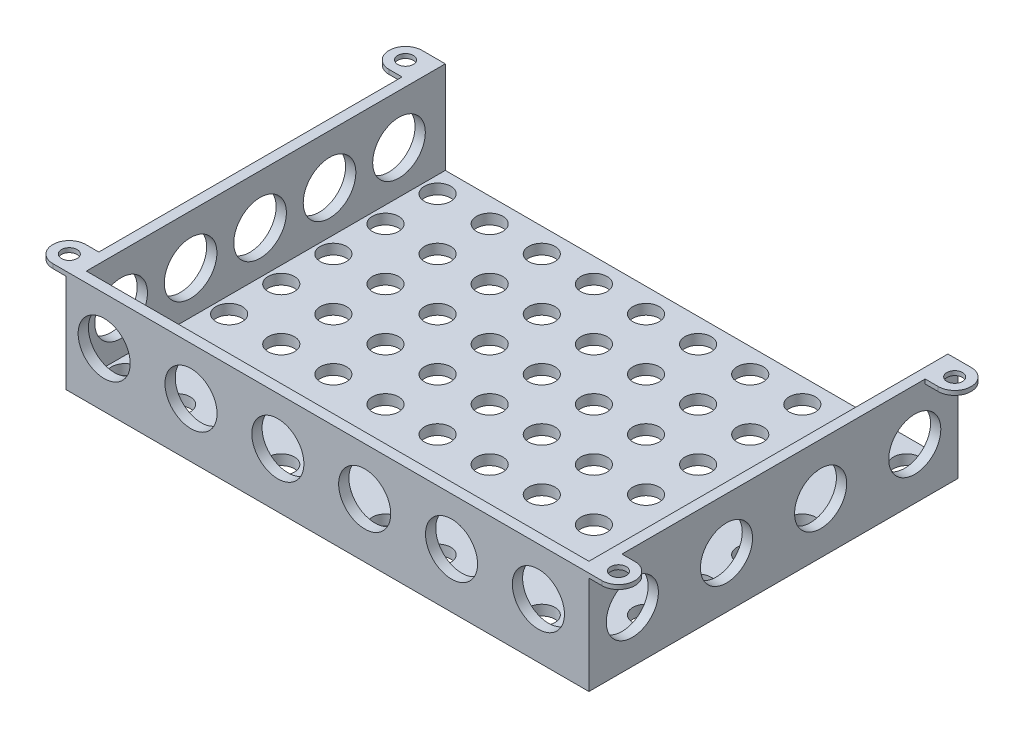
from build123d import *

# Parameters (mm, degrees)
SKETCH1_W                  = 153
SKETCH1_H                  = 108
BOSS_EXTRUDE1_DEPTH        = 30
SHELL1_T                   = -3
SKETCH7_R                  = 2.286
BOSS_EXTRUDE7_DEPTH        = 1.27
SKETCH24_R                 = 3.845268573
CUT_EXTRUDE8_DEPTH         = 25.4
LPATTERN5_COUNT            = 10
LPATTERN5_PITCH            = 15.24
LPATTERN6_COPY_1_SKETCH_R  = 3.845268573
LPATTERN6_COPY_1_DEPTH     = 25.4
LPATTERN6_COPY_2_SKETCH_R  = 3.845268573
LPATTERN6_COPY_2_DEPTH     = 25.4
LPATTERN6_COPY_3_SKETCH_R  = 3.845268573
LPATTERN6_COPY_3_DEPTH     = 25.4
LPATTERN6_COPY_4_SKETCH_R  = 3.845268573
LPATTERN6_COPY_4_DEPTH     = 25.4
LPATTERN6_COPY_5_SKETCH_R  = 3.845268573
LPATTERN6_COPY_5_DEPTH     = 25.4
LPATTERN6_COPY_6_SKETCH_R  = 3.845268573
LPATTERN6_COPY_6_DEPTH     = 25.4
LPATTERN6_COPY_7_SKETCH_R  = 3.845268573
LPATTERN6_COPY_7_DEPTH     = 25.4
LPATTERN6_COPY_8_SKETCH_R  = 3.845268573
LPATTERN6_COPY_8_DEPTH     = 25.4
LPATTERN6_COPY_9_SKETCH_R  = 3.845268573
LPATTERN6_COPY_9_DEPTH     = 25.4
LPATTERN6_COPY_10_SKETCH_R = 3.845268573
LPATTERN6_COPY_10_DEPTH    = 25.4
LPATTERN6_COPY_11_SKETCH_R = 3.845268573
LPATTERN6_COPY_11_DEPTH    = 25.4
LPATTERN6_COPY_12_SKETCH_R = 3.845268573
LPATTERN6_COPY_12_DEPTH    = 25.4
LPATTERN6_COPY_13_SKETCH_R = 3.845268573
LPATTERN6_COPY_13_DEPTH    = 25.4
LPATTERN6_COPY_14_SKETCH_R = 3.845268573
LPATTERN6_COPY_14_DEPTH    = 25.4
LPATTERN6_COPY_15_SKETCH_R = 3.845268573
LPATTERN6_COPY_15_DEPTH    = 25.4
LPATTERN6_COPY_16_SKETCH_R = 3.845268573
LPATTERN6_COPY_16_DEPTH    = 25.4
LPATTERN6_COPY_17_SKETCH_R = 3.845268573
LPATTERN6_COPY_17_DEPTH    = 25.4
LPATTERN6_COPY_18_SKETCH_R = 3.845268573
LPATTERN6_COPY_18_DEPTH    = 25.4
LPATTERN6_COPY_19_SKETCH_R = 3.845268573
LPATTERN6_COPY_19_DEPTH    = 25.4
LPATTERN6_COPY_20_SKETCH_R = 3.845268573
LPATTERN6_COPY_20_DEPTH    = 25.4
LPATTERN6_COPY_21_SKETCH_R = 3.845268573
LPATTERN6_COPY_21_DEPTH    = 25.4
LPATTERN6_COPY_22_SKETCH_R = 3.845268573
LPATTERN6_COPY_22_DEPTH    = 25.4
LPATTERN6_COPY_23_SKETCH_R = 3.845268573
LPATTERN6_COPY_23_DEPTH    = 25.4
LPATTERN6_COPY_24_SKETCH_R = 3.845268573
LPATTERN6_COPY_24_DEPTH    = 25.4
LPATTERN6_COPY_25_SKETCH_R = 3.845268573
LPATTERN6_COPY_25_DEPTH    = 25.4
LPATTERN6_COPY_26_SKETCH_R = 3.845268573
LPATTERN6_COPY_26_DEPTH    = 25.4
LPATTERN6_COPY_27_SKETCH_R = 3.845268573
LPATTERN6_COPY_27_DEPTH    = 25.4
LPATTERN6_COPY_28_SKETCH_R = 3.845268573
LPATTERN6_COPY_28_DEPTH    = 25.4
LPATTERN6_COPY_29_SKETCH_R = 3.845268573
LPATTERN6_COPY_29_DEPTH    = 25.4
LPATTERN6_COPY_30_SKETCH_R = 3.845268573
LPATTERN6_COPY_30_DEPTH    = 25.4
LPATTERN6_COPY_31_SKETCH_R = 3.845268573
LPATTERN6_COPY_31_DEPTH    = 25.4
LPATTERN6_COPY_32_SKETCH_R = 3.845268573
LPATTERN6_COPY_32_DEPTH    = 25.4
LPATTERN6_COPY_33_SKETCH_R = 3.845268573
LPATTERN6_COPY_33_DEPTH    = 25.4
LPATTERN6_COPY_34_SKETCH_R = 3.845268573
LPATTERN6_COPY_34_DEPTH    = 25.4
LPATTERN6_COPY_35_SKETCH_R = 3.845268573
LPATTERN6_COPY_35_DEPTH    = 25.4
LPATTERN6_COPY_36_SKETCH_R = 3.845268573
LPATTERN6_COPY_36_DEPTH    = 25.4
LPATTERN6_COPY_37_SKETCH_R = 3.845268573
LPATTERN6_COPY_37_DEPTH    = 25.4
LPATTERN6_COPY_38_SKETCH_R = 3.845268573
LPATTERN6_COPY_38_DEPTH    = 25.4
LPATTERN6_COPY_39_SKETCH_R = 3.845268573
LPATTERN6_COPY_39_DEPTH    = 25.4
LPATTERN6_COPY_40_SKETCH_R = 3.845268573
LPATTERN6_COPY_40_DEPTH    = 25.4
LPATTERN6_COPY_41_SKETCH_R = 3.845268573
LPATTERN6_COPY_41_DEPTH    = 25.4
LPATTERN6_COPY_42_SKETCH_R = 3.845268573
LPATTERN6_COPY_42_DEPTH    = 25.4
LPATTERN6_COPY_43_SKETCH_R = 3.845268573
LPATTERN6_COPY_43_DEPTH    = 25.4
LPATTERN6_COPY_44_SKETCH_R = 3.845268573
LPATTERN6_COPY_44_DEPTH    = 25.4
LPATTERN6_COPY_45_SKETCH_R = 3.845268573
LPATTERN6_COPY_45_DEPTH    = 25.4
LPATTERN6_COPY_46_SKETCH_R = 3.845268573
LPATTERN6_COPY_46_DEPTH    = 25.4
LPATTERN6_COPY_47_SKETCH_R = 3.845268573
LPATTERN6_COPY_47_DEPTH    = 25.4
LPATTERN6_COPY_48_SKETCH_R = 3.845268573
LPATTERN6_COPY_48_DEPTH    = 25.4
LPATTERN6_COPY_49_SKETCH_R = 3.845268573
LPATTERN6_COPY_49_DEPTH    = 25.4
LPATTERN6_COPY_50_SKETCH_R = 3.845268573
LPATTERN6_COPY_50_DEPTH    = 25.4
LPATTERN6_COPY_51_SKETCH_R = 3.845268573
LPATTERN6_COPY_51_DEPTH    = 25.4
LPATTERN6_COPY_52_SKETCH_R = 3.845268573
LPATTERN6_COPY_52_DEPTH    = 25.4
LPATTERN6_COPY_53_SKETCH_R = 3.845268573
LPATTERN6_COPY_53_DEPTH    = 25.4
LPATTERN6_COPY_54_SKETCH_R = 3.845268573
LPATTERN6_COPY_54_DEPTH    = 25.4
LPATTERN6_COPY_55_SKETCH_R = 3.845268573
LPATTERN6_COPY_55_DEPTH    = 25.4
LPATTERN6_COPY_56_SKETCH_R = 3.845268573
LPATTERN6_COPY_56_DEPTH    = 25.4
LPATTERN6_COPY_57_SKETCH_R = 3.845268573
LPATTERN6_COPY_57_DEPTH    = 25.4
LPATTERN6_COPY_58_SKETCH_R = 3.845268573
LPATTERN6_COPY_58_DEPTH    = 25.4
LPATTERN6_COPY_59_SKETCH_R = 3.845268573
LPATTERN6_COPY_59_DEPTH    = 25.4
LPATTERN6_COPY_60_SKETCH_R = 3.845268573
LPATTERN6_COPY_60_DEPTH    = 25.4
LPATTERN6_COPY_61_SKETCH_R = 3.845268573
LPATTERN6_COPY_61_DEPTH    = 25.4
LPATTERN6_COPY_62_SKETCH_R = 3.845268573
LPATTERN6_COPY_62_DEPTH    = 25.4
LPATTERN6_COPY_63_SKETCH_R = 3.845268573
LPATTERN6_COPY_63_DEPTH    = 25.4
LPATTERN6_COPY_64_SKETCH_R = 3.845268573
LPATTERN6_COPY_64_DEPTH    = 25.4
LPATTERN6_COPY_65_SKETCH_R = 3.845268573
LPATTERN6_COPY_65_DEPTH    = 25.4
LPATTERN6_COPY_66_SKETCH_R = 3.845268573
LPATTERN6_COPY_66_DEPTH    = 25.4
LPATTERN6_COPY_67_SKETCH_R = 3.845268573
LPATTERN6_COPY_67_DEPTH    = 25.4
LPATTERN6_COPY_68_SKETCH_R = 3.845268573
LPATTERN6_COPY_68_DEPTH    = 25.4
LPATTERN6_COPY_69_SKETCH_R = 3.845268573
LPATTERN6_COPY_69_DEPTH    = 25.4
LPATTERN6_COPY_70_SKETCH_R = 3.845268573
LPATTERN6_COPY_70_DEPTH    = 25.4
LPATTERN6_COPY_71_SKETCH_R = 3.845268573
LPATTERN6_COPY_71_DEPTH    = 25.4
LPATTERN6_COPY_72_SKETCH_R = 3.845268573
LPATTERN6_COPY_72_DEPTH    = 25.4
LPATTERN6_COPY_73_SKETCH_R = 3.845268573
LPATTERN6_COPY_73_DEPTH    = 25.4
LPATTERN6_COPY_74_SKETCH_R = 3.845268573
LPATTERN6_COPY_74_DEPTH    = 25.4
LPATTERN6_COPY_75_SKETCH_R = 3.845268573
LPATTERN6_COPY_75_DEPTH    = 25.4
LPATTERN6_COPY_76_SKETCH_R = 3.845268573
LPATTERN6_COPY_76_DEPTH    = 25.4
LPATTERN6_COPY_77_SKETCH_R = 3.845268573
LPATTERN6_COPY_77_DEPTH    = 25.4
LPATTERN6_COPY_78_SKETCH_R = 3.845268573
LPATTERN6_COPY_78_DEPTH    = 25.4
LPATTERN6_COPY_79_SKETCH_R = 3.845268573
LPATTERN6_COPY_79_DEPTH    = 25.4
LPATTERN6_COPY_80_SKETCH_R = 3.845268573
LPATTERN6_COPY_80_DEPTH    = 25.4
LPATTERN6_COPY_81_SKETCH_R = 3.845268573
LPATTERN6_COPY_81_DEPTH    = 25.4
LPATTERN6_COPY_82_SKETCH_R = 3.845268573
LPATTERN6_COPY_82_DEPTH    = 25.4
LPATTERN6_COPY_83_SKETCH_R = 3.845268573
LPATTERN6_COPY_83_DEPTH    = 25.4
LPATTERN6_COPY_84_SKETCH_R = 3.845268573
LPATTERN6_COPY_84_DEPTH    = 25.4
LPATTERN6_COPY_85_SKETCH_R = 3.845268573
LPATTERN6_COPY_85_DEPTH    = 25.4
LPATTERN6_COPY_86_SKETCH_R = 3.845268573
LPATTERN6_COPY_86_DEPTH    = 25.4
LPATTERN6_COPY_87_SKETCH_R = 3.845268573
LPATTERN6_COPY_87_DEPTH    = 25.4
LPATTERN6_COPY_88_SKETCH_R = 3.845268573
LPATTERN6_COPY_88_DEPTH    = 25.4
LPATTERN6_COPY_89_SKETCH_R = 3.845268573
LPATTERN6_COPY_89_DEPTH    = 25.4
LPATTERN6_COPY_90_SKETCH_R = 3.845268573
LPATTERN6_COPY_90_DEPTH    = 25.4
SKETCH27_W                 = 147
SKETCH27_H                 = 27
CUT_EXTRUDE10_DEPTH        = 5.08
SKETCH28_R                 = 7.698234168
CUT_EXTRUDE11_DEPTH        = 10.16
LPATTERN7_COUNT            = 5
LPATTERN7_PITCH            = 20.32
SKETCH29_R                 = 7.62
CUT_EXTRUDE13_DEPTH        = 7.62
LPATTERN9_COUNT            = 6
LPATTERN9_PITCH            = 25.4
SKETCH30_R                 = 7.62
CUT_EXTRUDE14_DEPTH        = 7.62
MIRROR2_COPY_1_SKETCH_R    = 2.286
MIRROR2_COPY_1_DEPTH       = 1.27
MIRROR2_COPY_2_SKETCH_R    = 2.286
MIRROR2_COPY_2_DEPTH       = 1.27


with BuildPart() as part:
    # Sketch1 → Boss-Extrude1 (new body)
    with BuildSketch(Plane(origin=(0, 0, 0), x_dir=(1, 0, 0), z_dir=(0, 1, 0))):
        with Locations((-76.5, -54)):
            Rectangle(SKETCH1_W, SKETCH1_H)
    extrude(amount=BOSS_EXTRUDE1_DEPTH)

    # Shell1
    shell1_openings = [part.faces().sort_by_distance(p)[0] for p in [
        (-76.5, 30, 54),
    ]]
    offset(amount=SHELL1_T, openings=shell1_openings, kind=Kind.INTERSECTION)

    # Sketch7 → Boss-Extrude7 (add)
    with BuildSketch(Plane(origin=(0, 30, 0), x_dir=(1, 0, 0), z_dir=(0, 1, 0))):
        with BuildLine():
            Line((-156.81, 0), (-153, 0))
            Line((-153, 0), (-153, -9.652))
            Line((-153, -9.652), (-156.81, -9.652))
            ThreePointArc((-156.81, -9.652), (-161.636, -4.826), (-156.81, 0))
        make_face()
        with Locations((-156.81, -4.826)):
            Circle(SKETCH7_R, mode=Mode.SUBTRACT)
    boss_extrude7 = extrude(amount=-BOSS_EXTRUDE7_DEPTH)

    # Sketch24 → Cut-Extrude8 (cut)
    with BuildSketch(Plane.XZ):
        with Locations((-8.055715174, 7.051094555)):
            Circle(SKETCH24_R)
    cut_extrude8 = extrude(amount=-CUT_EXTRUDE8_DEPTH, mode=Mode.SUBTRACT)

    # LPattern5: Cut-Extrude8 ×10
    with Locations(*[(-i * LPATTERN5_PITCH, 0, 0) for i in range(1, LPATTERN5_COUNT)]):
        add(cut_extrude8, mode=Mode.SUBTRACT)

    # LPattern6 copy 1 sketch → LPattern6 copy 1 (cut)
    with BuildSketch(Plane(origin=(-15.24, 0, 15.24), x_dir=(1, 0, 0), z_dir=(0, -1, 0))):
        with Locations((-8.055715174, 7.051094555)):
            Circle(LPATTERN6_COPY_1_SKETCH_R)
    extrude(amount=-LPATTERN6_COPY_1_DEPTH, mode=Mode.SUBTRACT)

    # LPattern6 copy 2 sketch → LPattern6 copy 2 (cut)
    with BuildSketch(Plane(origin=(-15.24, 0, 30.48), x_dir=(1, 0, 0), z_dir=(0, -1, 0))):
        with Locations((-8.055715174, 7.051094555)):
            Circle(LPATTERN6_COPY_2_SKETCH_R)
    extrude(amount=-LPATTERN6_COPY_2_DEPTH, mode=Mode.SUBTRACT)

    # LPattern6 copy 3 sketch → LPattern6 copy 3 (cut)
    with BuildSketch(Plane(origin=(-15.24, 0, 45.72), x_dir=(1, 0, 0), z_dir=(0, -1, 0))):
        with Locations((-8.055715174, 7.051094555)):
            Circle(LPATTERN6_COPY_3_SKETCH_R)
    extrude(amount=-LPATTERN6_COPY_3_DEPTH, mode=Mode.SUBTRACT)

    # LPattern6 copy 4 sketch → LPattern6 copy 4 (cut)
    with BuildSketch(Plane(origin=(-15.24, 0, 60.96), x_dir=(1, 0, 0), z_dir=(0, -1, 0))):
        with Locations((-8.055715174, 7.051094555)):
            Circle(LPATTERN6_COPY_4_SKETCH_R)
    extrude(amount=-LPATTERN6_COPY_4_DEPTH, mode=Mode.SUBTRACT)

    # LPattern6 copy 5 sketch → LPattern6 copy 5 (cut)
    with BuildSketch(Plane(origin=(-15.24, 0, 76.2), x_dir=(1, 0, 0), z_dir=(0, -1, 0))):
        with Locations((-8.055715174, 7.051094555)):
            Circle(LPATTERN6_COPY_5_SKETCH_R)
    extrude(amount=-LPATTERN6_COPY_5_DEPTH, mode=Mode.SUBTRACT)

    # LPattern6 copy 6 sketch → LPattern6 copy 6 (cut)
    with BuildSketch(Plane(origin=(-15.24, 0, 91.44), x_dir=(1, 0, 0), z_dir=(0, -1, 0))):
        with Locations((-8.055715174, 7.051094555)):
            Circle(LPATTERN6_COPY_6_SKETCH_R)
    extrude(amount=-LPATTERN6_COPY_6_DEPTH, mode=Mode.SUBTRACT)

    # LPattern6 copy 7 sketch → LPattern6 copy 7 (cut)
    with BuildSketch(Plane(origin=(-15.24, 0, 106.68), x_dir=(1, 0, 0), z_dir=(0, -1, 0))):
        with Locations((-8.055715174, 7.051094555)):
            Circle(LPATTERN6_COPY_7_SKETCH_R)
    extrude(amount=-LPATTERN6_COPY_7_DEPTH, mode=Mode.SUBTRACT)

    # LPattern6 copy 8 sketch → LPattern6 copy 8 (cut)
    with BuildSketch(Plane(origin=(-15.24, 0, 121.92), x_dir=(1, 0, 0), z_dir=(0, -1, 0))):
        with Locations((-8.055715174, 7.051094555)):
            Circle(LPATTERN6_COPY_8_SKETCH_R)
    extrude(amount=-LPATTERN6_COPY_8_DEPTH, mode=Mode.SUBTRACT)

    # LPattern6 copy 9 sketch → LPattern6 copy 9 (cut)
    with BuildSketch(Plane(origin=(-15.24, 0, 137.16), x_dir=(1, 0, 0), z_dir=(0, -1, 0))):
        with Locations((-8.055715174, 7.051094555)):
            Circle(LPATTERN6_COPY_9_SKETCH_R)
    extrude(amount=-LPATTERN6_COPY_9_DEPTH, mode=Mode.SUBTRACT)

    # LPattern6 copy 10 sketch → LPattern6 copy 10 (cut)
    with BuildSketch(Plane(origin=(-30.48, 0, 15.24), x_dir=(1, 0, 0), z_dir=(0, -1, 0))):
        with Locations((-8.055715174, 7.051094555)):
            Circle(LPATTERN6_COPY_10_SKETCH_R)
    extrude(amount=-LPATTERN6_COPY_10_DEPTH, mode=Mode.SUBTRACT)

    # LPattern6 copy 11 sketch → LPattern6 copy 11 (cut)
    with BuildSketch(Plane(origin=(-30.48, 0, 30.48), x_dir=(1, 0, 0), z_dir=(0, -1, 0))):
        with Locations((-8.055715174, 7.051094555)):
            Circle(LPATTERN6_COPY_11_SKETCH_R)
    extrude(amount=-LPATTERN6_COPY_11_DEPTH, mode=Mode.SUBTRACT)

    # LPattern6 copy 12 sketch → LPattern6 copy 12 (cut)
    with BuildSketch(Plane(origin=(-30.48, 0, 45.72), x_dir=(1, 0, 0), z_dir=(0, -1, 0))):
        with Locations((-8.055715174, 7.051094555)):
            Circle(LPATTERN6_COPY_12_SKETCH_R)
    extrude(amount=-LPATTERN6_COPY_12_DEPTH, mode=Mode.SUBTRACT)

    # LPattern6 copy 13 sketch → LPattern6 copy 13 (cut)
    with BuildSketch(Plane(origin=(-30.48, 0, 60.96), x_dir=(1, 0, 0), z_dir=(0, -1, 0))):
        with Locations((-8.055715174, 7.051094555)):
            Circle(LPATTERN6_COPY_13_SKETCH_R)
    extrude(amount=-LPATTERN6_COPY_13_DEPTH, mode=Mode.SUBTRACT)

    # LPattern6 copy 14 sketch → LPattern6 copy 14 (cut)
    with BuildSketch(Plane(origin=(-30.48, 0, 76.2), x_dir=(1, 0, 0), z_dir=(0, -1, 0))):
        with Locations((-8.055715174, 7.051094555)):
            Circle(LPATTERN6_COPY_14_SKETCH_R)
    extrude(amount=-LPATTERN6_COPY_14_DEPTH, mode=Mode.SUBTRACT)

    # LPattern6 copy 15 sketch → LPattern6 copy 15 (cut)
    with BuildSketch(Plane(origin=(-30.48, 0, 91.44), x_dir=(1, 0, 0), z_dir=(0, -1, 0))):
        with Locations((-8.055715174, 7.051094555)):
            Circle(LPATTERN6_COPY_15_SKETCH_R)
    extrude(amount=-LPATTERN6_COPY_15_DEPTH, mode=Mode.SUBTRACT)

    # LPattern6 copy 16 sketch → LPattern6 copy 16 (cut)
    with BuildSketch(Plane(origin=(-30.48, 0, 106.68), x_dir=(1, 0, 0), z_dir=(0, -1, 0))):
        with Locations((-8.055715174, 7.051094555)):
            Circle(LPATTERN6_COPY_16_SKETCH_R)
    extrude(amount=-LPATTERN6_COPY_16_DEPTH, mode=Mode.SUBTRACT)

    # LPattern6 copy 17 sketch → LPattern6 copy 17 (cut)
    with BuildSketch(Plane(origin=(-30.48, 0, 121.92), x_dir=(1, 0, 0), z_dir=(0, -1, 0))):
        with Locations((-8.055715174, 7.051094555)):
            Circle(LPATTERN6_COPY_17_SKETCH_R)
    extrude(amount=-LPATTERN6_COPY_17_DEPTH, mode=Mode.SUBTRACT)

    # LPattern6 copy 18 sketch → LPattern6 copy 18 (cut)
    with BuildSketch(Plane(origin=(-30.48, 0, 137.16), x_dir=(1, 0, 0), z_dir=(0, -1, 0))):
        with Locations((-8.055715174, 7.051094555)):
            Circle(LPATTERN6_COPY_18_SKETCH_R)
    extrude(amount=-LPATTERN6_COPY_18_DEPTH, mode=Mode.SUBTRACT)

    # LPattern6 copy 19 sketch → LPattern6 copy 19 (cut)
    with BuildSketch(Plane(origin=(-45.72, 0, 15.24), x_dir=(1, 0, 0), z_dir=(0, -1, 0))):
        with Locations((-8.055715174, 7.051094555)):
            Circle(LPATTERN6_COPY_19_SKETCH_R)
    extrude(amount=-LPATTERN6_COPY_19_DEPTH, mode=Mode.SUBTRACT)

    # LPattern6 copy 20 sketch → LPattern6 copy 20 (cut)
    with BuildSketch(Plane(origin=(-45.72, 0, 30.48), x_dir=(1, 0, 0), z_dir=(0, -1, 0))):
        with Locations((-8.055715174, 7.051094555)):
            Circle(LPATTERN6_COPY_20_SKETCH_R)
    extrude(amount=-LPATTERN6_COPY_20_DEPTH, mode=Mode.SUBTRACT)

    # LPattern6 copy 21 sketch → LPattern6 copy 21 (cut)
    with BuildSketch(Plane(origin=(-45.72, 0, 45.72), x_dir=(1, 0, 0), z_dir=(0, -1, 0))):
        with Locations((-8.055715174, 7.051094555)):
            Circle(LPATTERN6_COPY_21_SKETCH_R)
    extrude(amount=-LPATTERN6_COPY_21_DEPTH, mode=Mode.SUBTRACT)

    # LPattern6 copy 22 sketch → LPattern6 copy 22 (cut)
    with BuildSketch(Plane(origin=(-45.72, 0, 60.96), x_dir=(1, 0, 0), z_dir=(0, -1, 0))):
        with Locations((-8.055715174, 7.051094555)):
            Circle(LPATTERN6_COPY_22_SKETCH_R)
    extrude(amount=-LPATTERN6_COPY_22_DEPTH, mode=Mode.SUBTRACT)

    # LPattern6 copy 23 sketch → LPattern6 copy 23 (cut)
    with BuildSketch(Plane(origin=(-45.72, 0, 76.2), x_dir=(1, 0, 0), z_dir=(0, -1, 0))):
        with Locations((-8.055715174, 7.051094555)):
            Circle(LPATTERN6_COPY_23_SKETCH_R)
    extrude(amount=-LPATTERN6_COPY_23_DEPTH, mode=Mode.SUBTRACT)

    # LPattern6 copy 24 sketch → LPattern6 copy 24 (cut)
    with BuildSketch(Plane(origin=(-45.72, 0, 91.44), x_dir=(1, 0, 0), z_dir=(0, -1, 0))):
        with Locations((-8.055715174, 7.051094555)):
            Circle(LPATTERN6_COPY_24_SKETCH_R)
    extrude(amount=-LPATTERN6_COPY_24_DEPTH, mode=Mode.SUBTRACT)

    # LPattern6 copy 25 sketch → LPattern6 copy 25 (cut)
    with BuildSketch(Plane(origin=(-45.72, 0, 106.68), x_dir=(1, 0, 0), z_dir=(0, -1, 0))):
        with Locations((-8.055715174, 7.051094555)):
            Circle(LPATTERN6_COPY_25_SKETCH_R)
    extrude(amount=-LPATTERN6_COPY_25_DEPTH, mode=Mode.SUBTRACT)

    # LPattern6 copy 26 sketch → LPattern6 copy 26 (cut)
    with BuildSketch(Plane(origin=(-45.72, 0, 121.92), x_dir=(1, 0, 0), z_dir=(0, -1, 0))):
        with Locations((-8.055715174, 7.051094555)):
            Circle(LPATTERN6_COPY_26_SKETCH_R)
    extrude(amount=-LPATTERN6_COPY_26_DEPTH, mode=Mode.SUBTRACT)

    # LPattern6 copy 27 sketch → LPattern6 copy 27 (cut)
    with BuildSketch(Plane(origin=(-45.72, 0, 137.16), x_dir=(1, 0, 0), z_dir=(0, -1, 0))):
        with Locations((-8.055715174, 7.051094555)):
            Circle(LPATTERN6_COPY_27_SKETCH_R)
    extrude(amount=-LPATTERN6_COPY_27_DEPTH, mode=Mode.SUBTRACT)

    # LPattern6 copy 28 sketch → LPattern6 copy 28 (cut)
    with BuildSketch(Plane(origin=(-60.96, 0, 15.24), x_dir=(1, 0, 0), z_dir=(0, -1, 0))):
        with Locations((-8.055715174, 7.051094555)):
            Circle(LPATTERN6_COPY_28_SKETCH_R)
    extrude(amount=-LPATTERN6_COPY_28_DEPTH, mode=Mode.SUBTRACT)

    # LPattern6 copy 29 sketch → LPattern6 copy 29 (cut)
    with BuildSketch(Plane(origin=(-60.96, 0, 30.48), x_dir=(1, 0, 0), z_dir=(0, -1, 0))):
        with Locations((-8.055715174, 7.051094555)):
            Circle(LPATTERN6_COPY_29_SKETCH_R)
    extrude(amount=-LPATTERN6_COPY_29_DEPTH, mode=Mode.SUBTRACT)

    # LPattern6 copy 30 sketch → LPattern6 copy 30 (cut)
    with BuildSketch(Plane(origin=(-60.96, 0, 45.72), x_dir=(1, 0, 0), z_dir=(0, -1, 0))):
        with Locations((-8.055715174, 7.051094555)):
            Circle(LPATTERN6_COPY_30_SKETCH_R)
    extrude(amount=-LPATTERN6_COPY_30_DEPTH, mode=Mode.SUBTRACT)

    # LPattern6 copy 31 sketch → LPattern6 copy 31 (cut)
    with BuildSketch(Plane(origin=(-60.96, 0, 60.96), x_dir=(1, 0, 0), z_dir=(0, -1, 0))):
        with Locations((-8.055715174, 7.051094555)):
            Circle(LPATTERN6_COPY_31_SKETCH_R)
    extrude(amount=-LPATTERN6_COPY_31_DEPTH, mode=Mode.SUBTRACT)

    # LPattern6 copy 32 sketch → LPattern6 copy 32 (cut)
    with BuildSketch(Plane(origin=(-60.96, 0, 76.2), x_dir=(1, 0, 0), z_dir=(0, -1, 0))):
        with Locations((-8.055715174, 7.051094555)):
            Circle(LPATTERN6_COPY_32_SKETCH_R)
    extrude(amount=-LPATTERN6_COPY_32_DEPTH, mode=Mode.SUBTRACT)

    # LPattern6 copy 33 sketch → LPattern6 copy 33 (cut)
    with BuildSketch(Plane(origin=(-60.96, 0, 91.44), x_dir=(1, 0, 0), z_dir=(0, -1, 0))):
        with Locations((-8.055715174, 7.051094555)):
            Circle(LPATTERN6_COPY_33_SKETCH_R)
    extrude(amount=-LPATTERN6_COPY_33_DEPTH, mode=Mode.SUBTRACT)

    # LPattern6 copy 34 sketch → LPattern6 copy 34 (cut)
    with BuildSketch(Plane(origin=(-60.96, 0, 106.68), x_dir=(1, 0, 0), z_dir=(0, -1, 0))):
        with Locations((-8.055715174, 7.051094555)):
            Circle(LPATTERN6_COPY_34_SKETCH_R)
    extrude(amount=-LPATTERN6_COPY_34_DEPTH, mode=Mode.SUBTRACT)

    # LPattern6 copy 35 sketch → LPattern6 copy 35 (cut)
    with BuildSketch(Plane(origin=(-60.96, 0, 121.92), x_dir=(1, 0, 0), z_dir=(0, -1, 0))):
        with Locations((-8.055715174, 7.051094555)):
            Circle(LPATTERN6_COPY_35_SKETCH_R)
    extrude(amount=-LPATTERN6_COPY_35_DEPTH, mode=Mode.SUBTRACT)

    # LPattern6 copy 36 sketch → LPattern6 copy 36 (cut)
    with BuildSketch(Plane(origin=(-60.96, 0, 137.16), x_dir=(1, 0, 0), z_dir=(0, -1, 0))):
        with Locations((-8.055715174, 7.051094555)):
            Circle(LPATTERN6_COPY_36_SKETCH_R)
    extrude(amount=-LPATTERN6_COPY_36_DEPTH, mode=Mode.SUBTRACT)

    # LPattern6 copy 37 sketch → LPattern6 copy 37 (cut)
    with BuildSketch(Plane(origin=(-76.2, 0, 15.24), x_dir=(1, 0, 0), z_dir=(0, -1, 0))):
        with Locations((-8.055715174, 7.051094555)):
            Circle(LPATTERN6_COPY_37_SKETCH_R)
    extrude(amount=-LPATTERN6_COPY_37_DEPTH, mode=Mode.SUBTRACT)

    # LPattern6 copy 38 sketch → LPattern6 copy 38 (cut)
    with BuildSketch(Plane(origin=(-76.2, 0, 30.48), x_dir=(1, 0, 0), z_dir=(0, -1, 0))):
        with Locations((-8.055715174, 7.051094555)):
            Circle(LPATTERN6_COPY_38_SKETCH_R)
    extrude(amount=-LPATTERN6_COPY_38_DEPTH, mode=Mode.SUBTRACT)

    # LPattern6 copy 39 sketch → LPattern6 copy 39 (cut)
    with BuildSketch(Plane(origin=(-76.2, 0, 45.72), x_dir=(1, 0, 0), z_dir=(0, -1, 0))):
        with Locations((-8.055715174, 7.051094555)):
            Circle(LPATTERN6_COPY_39_SKETCH_R)
    extrude(amount=-LPATTERN6_COPY_39_DEPTH, mode=Mode.SUBTRACT)

    # LPattern6 copy 40 sketch → LPattern6 copy 40 (cut)
    with BuildSketch(Plane(origin=(-76.2, 0, 60.96), x_dir=(1, 0, 0), z_dir=(0, -1, 0))):
        with Locations((-8.055715174, 7.051094555)):
            Circle(LPATTERN6_COPY_40_SKETCH_R)
    extrude(amount=-LPATTERN6_COPY_40_DEPTH, mode=Mode.SUBTRACT)

    # LPattern6 copy 41 sketch → LPattern6 copy 41 (cut)
    with BuildSketch(Plane(origin=(-76.2, 0, 76.2), x_dir=(1, 0, 0), z_dir=(0, -1, 0))):
        with Locations((-8.055715174, 7.051094555)):
            Circle(LPATTERN6_COPY_41_SKETCH_R)
    extrude(amount=-LPATTERN6_COPY_41_DEPTH, mode=Mode.SUBTRACT)

    # LPattern6 copy 42 sketch → LPattern6 copy 42 (cut)
    with BuildSketch(Plane(origin=(-76.2, 0, 91.44), x_dir=(1, 0, 0), z_dir=(0, -1, 0))):
        with Locations((-8.055715174, 7.051094555)):
            Circle(LPATTERN6_COPY_42_SKETCH_R)
    extrude(amount=-LPATTERN6_COPY_42_DEPTH, mode=Mode.SUBTRACT)

    # LPattern6 copy 43 sketch → LPattern6 copy 43 (cut)
    with BuildSketch(Plane(origin=(-76.2, 0, 106.68), x_dir=(1, 0, 0), z_dir=(0, -1, 0))):
        with Locations((-8.055715174, 7.051094555)):
            Circle(LPATTERN6_COPY_43_SKETCH_R)
    extrude(amount=-LPATTERN6_COPY_43_DEPTH, mode=Mode.SUBTRACT)

    # LPattern6 copy 44 sketch → LPattern6 copy 44 (cut)
    with BuildSketch(Plane(origin=(-76.2, 0, 121.92), x_dir=(1, 0, 0), z_dir=(0, -1, 0))):
        with Locations((-8.055715174, 7.051094555)):
            Circle(LPATTERN6_COPY_44_SKETCH_R)
    extrude(amount=-LPATTERN6_COPY_44_DEPTH, mode=Mode.SUBTRACT)

    # LPattern6 copy 45 sketch → LPattern6 copy 45 (cut)
    with BuildSketch(Plane(origin=(-76.2, 0, 137.16), x_dir=(1, 0, 0), z_dir=(0, -1, 0))):
        with Locations((-8.055715174, 7.051094555)):
            Circle(LPATTERN6_COPY_45_SKETCH_R)
    extrude(amount=-LPATTERN6_COPY_45_DEPTH, mode=Mode.SUBTRACT)

    # LPattern6 copy 46 sketch → LPattern6 copy 46 (cut)
    with BuildSketch(Plane(origin=(-91.44, 0, 15.24), x_dir=(1, 0, 0), z_dir=(0, -1, 0))):
        with Locations((-8.055715174, 7.051094555)):
            Circle(LPATTERN6_COPY_46_SKETCH_R)
    extrude(amount=-LPATTERN6_COPY_46_DEPTH, mode=Mode.SUBTRACT)

    # LPattern6 copy 47 sketch → LPattern6 copy 47 (cut)
    with BuildSketch(Plane(origin=(-91.44, 0, 30.48), x_dir=(1, 0, 0), z_dir=(0, -1, 0))):
        with Locations((-8.055715174, 7.051094555)):
            Circle(LPATTERN6_COPY_47_SKETCH_R)
    extrude(amount=-LPATTERN6_COPY_47_DEPTH, mode=Mode.SUBTRACT)

    # LPattern6 copy 48 sketch → LPattern6 copy 48 (cut)
    with BuildSketch(Plane(origin=(-91.44, 0, 45.72), x_dir=(1, 0, 0), z_dir=(0, -1, 0))):
        with Locations((-8.055715174, 7.051094555)):
            Circle(LPATTERN6_COPY_48_SKETCH_R)
    extrude(amount=-LPATTERN6_COPY_48_DEPTH, mode=Mode.SUBTRACT)

    # LPattern6 copy 49 sketch → LPattern6 copy 49 (cut)
    with BuildSketch(Plane(origin=(-91.44, 0, 60.96), x_dir=(1, 0, 0), z_dir=(0, -1, 0))):
        with Locations((-8.055715174, 7.051094555)):
            Circle(LPATTERN6_COPY_49_SKETCH_R)
    extrude(amount=-LPATTERN6_COPY_49_DEPTH, mode=Mode.SUBTRACT)

    # LPattern6 copy 50 sketch → LPattern6 copy 50 (cut)
    with BuildSketch(Plane(origin=(-91.44, 0, 76.2), x_dir=(1, 0, 0), z_dir=(0, -1, 0))):
        with Locations((-8.055715174, 7.051094555)):
            Circle(LPATTERN6_COPY_50_SKETCH_R)
    extrude(amount=-LPATTERN6_COPY_50_DEPTH, mode=Mode.SUBTRACT)

    # LPattern6 copy 51 sketch → LPattern6 copy 51 (cut)
    with BuildSketch(Plane(origin=(-91.44, 0, 91.44), x_dir=(1, 0, 0), z_dir=(0, -1, 0))):
        with Locations((-8.055715174, 7.051094555)):
            Circle(LPATTERN6_COPY_51_SKETCH_R)
    extrude(amount=-LPATTERN6_COPY_51_DEPTH, mode=Mode.SUBTRACT)

    # LPattern6 copy 52 sketch → LPattern6 copy 52 (cut)
    with BuildSketch(Plane(origin=(-91.44, 0, 106.68), x_dir=(1, 0, 0), z_dir=(0, -1, 0))):
        with Locations((-8.055715174, 7.051094555)):
            Circle(LPATTERN6_COPY_52_SKETCH_R)
    extrude(amount=-LPATTERN6_COPY_52_DEPTH, mode=Mode.SUBTRACT)

    # LPattern6 copy 53 sketch → LPattern6 copy 53 (cut)
    with BuildSketch(Plane(origin=(-91.44, 0, 121.92), x_dir=(1, 0, 0), z_dir=(0, -1, 0))):
        with Locations((-8.055715174, 7.051094555)):
            Circle(LPATTERN6_COPY_53_SKETCH_R)
    extrude(amount=-LPATTERN6_COPY_53_DEPTH, mode=Mode.SUBTRACT)

    # LPattern6 copy 54 sketch → LPattern6 copy 54 (cut)
    with BuildSketch(Plane(origin=(-91.44, 0, 137.16), x_dir=(1, 0, 0), z_dir=(0, -1, 0))):
        with Locations((-8.055715174, 7.051094555)):
            Circle(LPATTERN6_COPY_54_SKETCH_R)
    extrude(amount=-LPATTERN6_COPY_54_DEPTH, mode=Mode.SUBTRACT)

    # LPattern6 copy 55 sketch → LPattern6 copy 55 (cut)
    with BuildSketch(Plane(origin=(-106.68, 0, 15.24), x_dir=(1, 0, 0), z_dir=(0, -1, 0))):
        with Locations((-8.055715174, 7.051094555)):
            Circle(LPATTERN6_COPY_55_SKETCH_R)
    extrude(amount=-LPATTERN6_COPY_55_DEPTH, mode=Mode.SUBTRACT)

    # LPattern6 copy 56 sketch → LPattern6 copy 56 (cut)
    with BuildSketch(Plane(origin=(-106.68, 0, 30.48), x_dir=(1, 0, 0), z_dir=(0, -1, 0))):
        with Locations((-8.055715174, 7.051094555)):
            Circle(LPATTERN6_COPY_56_SKETCH_R)
    extrude(amount=-LPATTERN6_COPY_56_DEPTH, mode=Mode.SUBTRACT)

    # LPattern6 copy 57 sketch → LPattern6 copy 57 (cut)
    with BuildSketch(Plane(origin=(-106.68, 0, 45.72), x_dir=(1, 0, 0), z_dir=(0, -1, 0))):
        with Locations((-8.055715174, 7.051094555)):
            Circle(LPATTERN6_COPY_57_SKETCH_R)
    extrude(amount=-LPATTERN6_COPY_57_DEPTH, mode=Mode.SUBTRACT)

    # LPattern6 copy 58 sketch → LPattern6 copy 58 (cut)
    with BuildSketch(Plane(origin=(-106.68, 0, 60.96), x_dir=(1, 0, 0), z_dir=(0, -1, 0))):
        with Locations((-8.055715174, 7.051094555)):
            Circle(LPATTERN6_COPY_58_SKETCH_R)
    extrude(amount=-LPATTERN6_COPY_58_DEPTH, mode=Mode.SUBTRACT)

    # LPattern6 copy 59 sketch → LPattern6 copy 59 (cut)
    with BuildSketch(Plane(origin=(-106.68, 0, 76.2), x_dir=(1, 0, 0), z_dir=(0, -1, 0))):
        with Locations((-8.055715174, 7.051094555)):
            Circle(LPATTERN6_COPY_59_SKETCH_R)
    extrude(amount=-LPATTERN6_COPY_59_DEPTH, mode=Mode.SUBTRACT)

    # LPattern6 copy 60 sketch → LPattern6 copy 60 (cut)
    with BuildSketch(Plane(origin=(-106.68, 0, 91.44), x_dir=(1, 0, 0), z_dir=(0, -1, 0))):
        with Locations((-8.055715174, 7.051094555)):
            Circle(LPATTERN6_COPY_60_SKETCH_R)
    extrude(amount=-LPATTERN6_COPY_60_DEPTH, mode=Mode.SUBTRACT)

    # LPattern6 copy 61 sketch → LPattern6 copy 61 (cut)
    with BuildSketch(Plane(origin=(-106.68, 0, 106.68), x_dir=(1, 0, 0), z_dir=(0, -1, 0))):
        with Locations((-8.055715174, 7.051094555)):
            Circle(LPATTERN6_COPY_61_SKETCH_R)
    extrude(amount=-LPATTERN6_COPY_61_DEPTH, mode=Mode.SUBTRACT)

    # LPattern6 copy 62 sketch → LPattern6 copy 62 (cut)
    with BuildSketch(Plane(origin=(-106.68, 0, 121.92), x_dir=(1, 0, 0), z_dir=(0, -1, 0))):
        with Locations((-8.055715174, 7.051094555)):
            Circle(LPATTERN6_COPY_62_SKETCH_R)
    extrude(amount=-LPATTERN6_COPY_62_DEPTH, mode=Mode.SUBTRACT)

    # LPattern6 copy 63 sketch → LPattern6 copy 63 (cut)
    with BuildSketch(Plane(origin=(-106.68, 0, 137.16), x_dir=(1, 0, 0), z_dir=(0, -1, 0))):
        with Locations((-8.055715174, 7.051094555)):
            Circle(LPATTERN6_COPY_63_SKETCH_R)
    extrude(amount=-LPATTERN6_COPY_63_DEPTH, mode=Mode.SUBTRACT)

    # LPattern6 copy 64 sketch → LPattern6 copy 64 (cut)
    with BuildSketch(Plane(origin=(-121.92, 0, 15.24), x_dir=(1, 0, 0), z_dir=(0, -1, 0))):
        with Locations((-8.055715174, 7.051094555)):
            Circle(LPATTERN6_COPY_64_SKETCH_R)
    extrude(amount=-LPATTERN6_COPY_64_DEPTH, mode=Mode.SUBTRACT)

    # LPattern6 copy 65 sketch → LPattern6 copy 65 (cut)
    with BuildSketch(Plane(origin=(-121.92, 0, 30.48), x_dir=(1, 0, 0), z_dir=(0, -1, 0))):
        with Locations((-8.055715174, 7.051094555)):
            Circle(LPATTERN6_COPY_65_SKETCH_R)
    extrude(amount=-LPATTERN6_COPY_65_DEPTH, mode=Mode.SUBTRACT)

    # LPattern6 copy 66 sketch → LPattern6 copy 66 (cut)
    with BuildSketch(Plane(origin=(-121.92, 0, 45.72), x_dir=(1, 0, 0), z_dir=(0, -1, 0))):
        with Locations((-8.055715174, 7.051094555)):
            Circle(LPATTERN6_COPY_66_SKETCH_R)
    extrude(amount=-LPATTERN6_COPY_66_DEPTH, mode=Mode.SUBTRACT)

    # LPattern6 copy 67 sketch → LPattern6 copy 67 (cut)
    with BuildSketch(Plane(origin=(-121.92, 0, 60.96), x_dir=(1, 0, 0), z_dir=(0, -1, 0))):
        with Locations((-8.055715174, 7.051094555)):
            Circle(LPATTERN6_COPY_67_SKETCH_R)
    extrude(amount=-LPATTERN6_COPY_67_DEPTH, mode=Mode.SUBTRACT)

    # LPattern6 copy 68 sketch → LPattern6 copy 68 (cut)
    with BuildSketch(Plane(origin=(-121.92, 0, 76.2), x_dir=(1, 0, 0), z_dir=(0, -1, 0))):
        with Locations((-8.055715174, 7.051094555)):
            Circle(LPATTERN6_COPY_68_SKETCH_R)
    extrude(amount=-LPATTERN6_COPY_68_DEPTH, mode=Mode.SUBTRACT)

    # LPattern6 copy 69 sketch → LPattern6 copy 69 (cut)
    with BuildSketch(Plane(origin=(-121.92, 0, 91.44), x_dir=(1, 0, 0), z_dir=(0, -1, 0))):
        with Locations((-8.055715174, 7.051094555)):
            Circle(LPATTERN6_COPY_69_SKETCH_R)
    extrude(amount=-LPATTERN6_COPY_69_DEPTH, mode=Mode.SUBTRACT)

    # LPattern6 copy 70 sketch → LPattern6 copy 70 (cut)
    with BuildSketch(Plane(origin=(-121.92, 0, 106.68), x_dir=(1, 0, 0), z_dir=(0, -1, 0))):
        with Locations((-8.055715174, 7.051094555)):
            Circle(LPATTERN6_COPY_70_SKETCH_R)
    extrude(amount=-LPATTERN6_COPY_70_DEPTH, mode=Mode.SUBTRACT)

    # LPattern6 copy 71 sketch → LPattern6 copy 71 (cut)
    with BuildSketch(Plane(origin=(-121.92, 0, 121.92), x_dir=(1, 0, 0), z_dir=(0, -1, 0))):
        with Locations((-8.055715174, 7.051094555)):
            Circle(LPATTERN6_COPY_71_SKETCH_R)
    extrude(amount=-LPATTERN6_COPY_71_DEPTH, mode=Mode.SUBTRACT)

    # LPattern6 copy 72 sketch → LPattern6 copy 72 (cut)
    with BuildSketch(Plane(origin=(-121.92, 0, 137.16), x_dir=(1, 0, 0), z_dir=(0, -1, 0))):
        with Locations((-8.055715174, 7.051094555)):
            Circle(LPATTERN6_COPY_72_SKETCH_R)
    extrude(amount=-LPATTERN6_COPY_72_DEPTH, mode=Mode.SUBTRACT)

    # LPattern6 copy 73 sketch → LPattern6 copy 73 (cut)
    with BuildSketch(Plane(origin=(-137.16, 0, 15.24), x_dir=(1, 0, 0), z_dir=(0, -1, 0))):
        with Locations((-8.055715174, 7.051094555)):
            Circle(LPATTERN6_COPY_73_SKETCH_R)
    extrude(amount=-LPATTERN6_COPY_73_DEPTH, mode=Mode.SUBTRACT)

    # LPattern6 copy 74 sketch → LPattern6 copy 74 (cut)
    with BuildSketch(Plane(origin=(-137.16, 0, 30.48), x_dir=(1, 0, 0), z_dir=(0, -1, 0))):
        with Locations((-8.055715174, 7.051094555)):
            Circle(LPATTERN6_COPY_74_SKETCH_R)
    extrude(amount=-LPATTERN6_COPY_74_DEPTH, mode=Mode.SUBTRACT)

    # LPattern6 copy 75 sketch → LPattern6 copy 75 (cut)
    with BuildSketch(Plane(origin=(-137.16, 0, 45.72), x_dir=(1, 0, 0), z_dir=(0, -1, 0))):
        with Locations((-8.055715174, 7.051094555)):
            Circle(LPATTERN6_COPY_75_SKETCH_R)
    extrude(amount=-LPATTERN6_COPY_75_DEPTH, mode=Mode.SUBTRACT)

    # LPattern6 copy 76 sketch → LPattern6 copy 76 (cut)
    with BuildSketch(Plane(origin=(-137.16, 0, 60.96), x_dir=(1, 0, 0), z_dir=(0, -1, 0))):
        with Locations((-8.055715174, 7.051094555)):
            Circle(LPATTERN6_COPY_76_SKETCH_R)
    extrude(amount=-LPATTERN6_COPY_76_DEPTH, mode=Mode.SUBTRACT)

    # LPattern6 copy 77 sketch → LPattern6 copy 77 (cut)
    with BuildSketch(Plane(origin=(-137.16, 0, 76.2), x_dir=(1, 0, 0), z_dir=(0, -1, 0))):
        with Locations((-8.055715174, 7.051094555)):
            Circle(LPATTERN6_COPY_77_SKETCH_R)
    extrude(amount=-LPATTERN6_COPY_77_DEPTH, mode=Mode.SUBTRACT)

    # LPattern6 copy 78 sketch → LPattern6 copy 78 (cut)
    with BuildSketch(Plane(origin=(-137.16, 0, 91.44), x_dir=(1, 0, 0), z_dir=(0, -1, 0))):
        with Locations((-8.055715174, 7.051094555)):
            Circle(LPATTERN6_COPY_78_SKETCH_R)
    extrude(amount=-LPATTERN6_COPY_78_DEPTH, mode=Mode.SUBTRACT)

    # LPattern6 copy 79 sketch → LPattern6 copy 79 (cut)
    with BuildSketch(Plane(origin=(-137.16, 0, 106.68), x_dir=(1, 0, 0), z_dir=(0, -1, 0))):
        with Locations((-8.055715174, 7.051094555)):
            Circle(LPATTERN6_COPY_79_SKETCH_R)
    extrude(amount=-LPATTERN6_COPY_79_DEPTH, mode=Mode.SUBTRACT)

    # LPattern6 copy 80 sketch → LPattern6 copy 80 (cut)
    with BuildSketch(Plane(origin=(-137.16, 0, 121.92), x_dir=(1, 0, 0), z_dir=(0, -1, 0))):
        with Locations((-8.055715174, 7.051094555)):
            Circle(LPATTERN6_COPY_80_SKETCH_R)
    extrude(amount=-LPATTERN6_COPY_80_DEPTH, mode=Mode.SUBTRACT)

    # LPattern6 copy 81 sketch → LPattern6 copy 81 (cut)
    with BuildSketch(Plane(origin=(-137.16, 0, 137.16), x_dir=(1, 0, 0), z_dir=(0, -1, 0))):
        with Locations((-8.055715174, 7.051094555)):
            Circle(LPATTERN6_COPY_81_SKETCH_R)
    extrude(amount=-LPATTERN6_COPY_81_DEPTH, mode=Mode.SUBTRACT)

    # LPattern6 copy 82 sketch → LPattern6 copy 82 (cut)
    with BuildSketch(Plane(origin=(0, 0, 15.24), x_dir=(1, 0, 0), z_dir=(0, -1, 0))):
        with Locations((-8.055715174, 7.051094555)):
            Circle(LPATTERN6_COPY_82_SKETCH_R)
    extrude(amount=-LPATTERN6_COPY_82_DEPTH, mode=Mode.SUBTRACT)

    # LPattern6 copy 83 sketch → LPattern6 copy 83 (cut)
    with BuildSketch(Plane(origin=(0, 0, 30.48), x_dir=(1, 0, 0), z_dir=(0, -1, 0))):
        with Locations((-8.055715174, 7.051094555)):
            Circle(LPATTERN6_COPY_83_SKETCH_R)
    extrude(amount=-LPATTERN6_COPY_83_DEPTH, mode=Mode.SUBTRACT)

    # LPattern6 copy 84 sketch → LPattern6 copy 84 (cut)
    with BuildSketch(Plane(origin=(0, 0, 45.72), x_dir=(1, 0, 0), z_dir=(0, -1, 0))):
        with Locations((-8.055715174, 7.051094555)):
            Circle(LPATTERN6_COPY_84_SKETCH_R)
    extrude(amount=-LPATTERN6_COPY_84_DEPTH, mode=Mode.SUBTRACT)

    # LPattern6 copy 85 sketch → LPattern6 copy 85 (cut)
    with BuildSketch(Plane(origin=(0, 0, 60.96), x_dir=(1, 0, 0), z_dir=(0, -1, 0))):
        with Locations((-8.055715174, 7.051094555)):
            Circle(LPATTERN6_COPY_85_SKETCH_R)
    extrude(amount=-LPATTERN6_COPY_85_DEPTH, mode=Mode.SUBTRACT)

    # LPattern6 copy 86 sketch → LPattern6 copy 86 (cut)
    with BuildSketch(Plane(origin=(0, 0, 76.2), x_dir=(1, 0, 0), z_dir=(0, -1, 0))):
        with Locations((-8.055715174, 7.051094555)):
            Circle(LPATTERN6_COPY_86_SKETCH_R)
    extrude(amount=-LPATTERN6_COPY_86_DEPTH, mode=Mode.SUBTRACT)

    # LPattern6 copy 87 sketch → LPattern6 copy 87 (cut)
    with BuildSketch(Plane(origin=(0, 0, 91.44), x_dir=(1, 0, 0), z_dir=(0, -1, 0))):
        with Locations((-8.055715174, 7.051094555)):
            Circle(LPATTERN6_COPY_87_SKETCH_R)
    extrude(amount=-LPATTERN6_COPY_87_DEPTH, mode=Mode.SUBTRACT)

    # LPattern6 copy 88 sketch → LPattern6 copy 88 (cut)
    with BuildSketch(Plane(origin=(0, 0, 106.68), x_dir=(1, 0, 0), z_dir=(0, -1, 0))):
        with Locations((-8.055715174, 7.051094555)):
            Circle(LPATTERN6_COPY_88_SKETCH_R)
    extrude(amount=-LPATTERN6_COPY_88_DEPTH, mode=Mode.SUBTRACT)

    # LPattern6 copy 89 sketch → LPattern6 copy 89 (cut)
    with BuildSketch(Plane(origin=(0, 0, 121.92), x_dir=(1, 0, 0), z_dir=(0, -1, 0))):
        with Locations((-8.055715174, 7.051094555)):
            Circle(LPATTERN6_COPY_89_SKETCH_R)
    extrude(amount=-LPATTERN6_COPY_89_DEPTH, mode=Mode.SUBTRACT)

    # LPattern6 copy 90 sketch → LPattern6 copy 90 (cut)
    with BuildSketch(Plane(origin=(0, 0, 137.16), x_dir=(1, 0, 0), z_dir=(0, -1, 0))):
        with Locations((-8.055715174, 7.051094555)):
            Circle(LPATTERN6_COPY_90_SKETCH_R)
    extrude(amount=-LPATTERN6_COPY_90_DEPTH, mode=Mode.SUBTRACT)

    # Sketch27 → Cut-Extrude10 (cut)
    with BuildSketch(Plane.XY.offset(3)):
        with Locations((-76.5, 16.5)):
            Rectangle(SKETCH27_W, SKETCH27_H)
    extrude(amount=-CUT_EXTRUDE10_DEPTH, mode=Mode.SUBTRACT)

    # Sketch28 → Cut-Extrude11 (cut)
    with BuildSketch(Plane.ZY.offset(153)):
        with Locations((94.827334785, 15.540195605)):
            Circle(SKETCH28_R)
    cut_extrude11 = extrude(amount=-CUT_EXTRUDE11_DEPTH, mode=Mode.SUBTRACT)

    # LPattern7: Cut-Extrude11 ×5
    with Locations(*[(0, 0, -i * LPATTERN7_PITCH) for i in range(1, LPATTERN7_COUNT)]):
        add(cut_extrude11, mode=Mode.SUBTRACT)

    # Sketch29 → Cut-Extrude13 (cut)
    with BuildSketch(Plane.XY.offset(108)):
        with Locations((-14.783799718, 16.002729164)):
            Circle(SKETCH29_R)
    cut_extrude13 = extrude(amount=-CUT_EXTRUDE13_DEPTH, mode=Mode.SUBTRACT)

    # LPattern9: Cut-Extrude13 ×6
    with Locations(*[(-i * LPATTERN9_PITCH, 0, 0) for i in range(1, LPATTERN9_COUNT)]):
        add(cut_extrude13, mode=Mode.SUBTRACT)

    # Sketch30 → Cut-Extrude14 (cut)
    with BuildSketch(Plane(origin=(0, 0, 0), x_dir=(0, 0, -1), z_dir=(1, 0, 0))):
        with Locations((-12.7, 15)):
            Circle(SKETCH30_R)
        with Locations((-40.233333333, 15)):
            Circle(SKETCH30_R)
        with Locations((-67.766666667, 15)):
            Circle(SKETCH30_R)
        with Locations((-95.3, 15)):
            Circle(SKETCH30_R)
    extrude(amount=-CUT_EXTRUDE14_DEPTH, mode=Mode.SUBTRACT)

    # Mirror1: Boss-Extrude7 across plane
    add(boss_extrude7.mirror(Plane(origin=(0, 0, 54), x_dir=(1, 0, 0), z_dir=(0, 0, -1))))

    # Mirror2 copy 1 sketch → Mirror2 copy 1 (add)
    with BuildSketch(Plane(origin=(-153, 30, 108), x_dir=(-1, 0, 0), z_dir=(0, 1, 0))):
        with BuildLine():
            Line((-156.81, 0), (-153, 0))
            Line((-153, 0), (-153, -9.652))
            Line((-153, -9.652), (-156.81, -9.652))
            ThreePointArc((-156.81, -9.652), (-161.636, -4.826), (-156.81, 0))
        make_face()
        with Locations((-156.81, -4.826)):
            Circle(MIRROR2_COPY_1_SKETCH_R, mode=Mode.SUBTRACT)
    extrude(amount=-MIRROR2_COPY_1_DEPTH)

    # Mirror2 copy 2 sketch → Mirror2 copy 2 (add)
    with BuildSketch(Plane(origin=(-153, 30, 0), x_dir=(-1, 0, 0), z_dir=(0, 1, 0))):
        with BuildLine():
            Line((-156.81, 0), (-153, 0))
            Line((-153, 0), (-153, 9.652))
            Line((-153, 9.652), (-156.81, 9.652))
            ThreePointArc((-156.81, 9.652), (-161.636, 4.826), (-156.81, 0))
        make_face()
        with Locations((-156.81, 4.826)):
            Circle(MIRROR2_COPY_2_SKETCH_R, mode=Mode.SUBTRACT)
    extrude(amount=-MIRROR2_COPY_2_DEPTH)


solid = part.part
